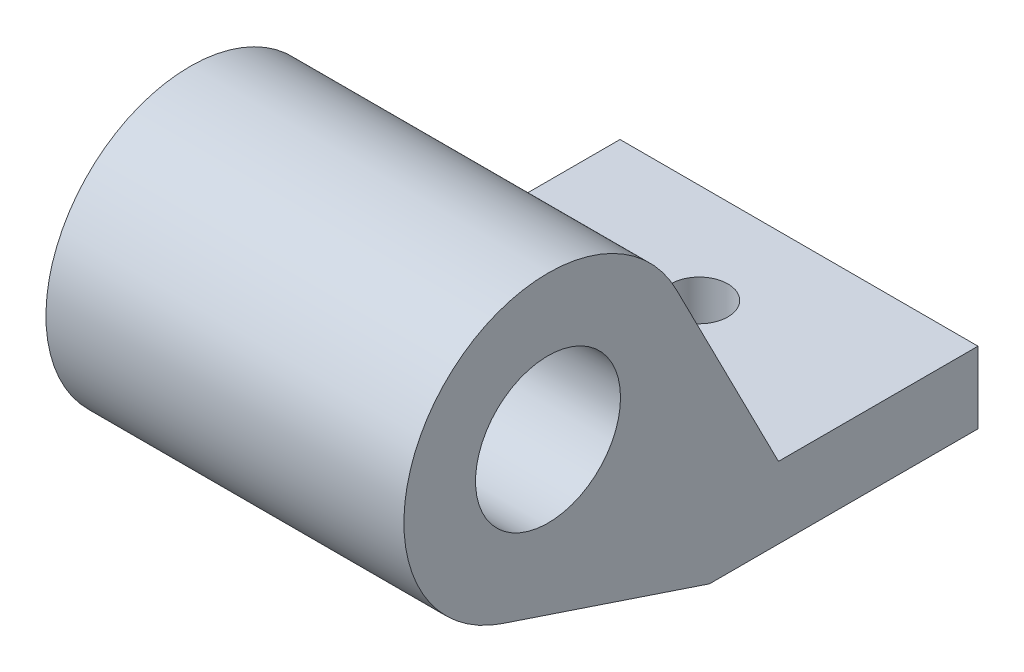
from build123d import *

# Parameters (mm, degrees)
SKETCH1_R           = 4.05
BOSS_EXTRUDE1_DEPTH = 20
SKETCH2_R           = 1.6
CUT_EXTRUDE1_DEPTH  = 36.293010976


with BuildPart() as part:
    # Sketch1 → Boss-Extrude1 (new body)
    with BuildSketch(Plane(origin=(0, 0, 0), x_dir=(0, 0, -1), z_dir=(1, 0, 0))):
        with BuildLine():
            Line((-7.5, 0), (7.5, 0))
            Line((7.5, 0), (7.5, 4))
            Line((7.5, 4), (-3.648390643, 4))
            Line((-3.648390643, 4), (-9.354926755, 15.163309731))
            ThreePointArc((-9.354926755, 15.163309731), (-22.626275854, 16.747943966), (-19.072034972, 3.863567989))
            Line((-19.072034972, 3.863567989), (-7.5, 0))
        make_face()
        with Locations((-16.5227062, 11.499235793)):
            Circle(SKETCH1_R, mode=Mode.SUBTRACT)
    extrude(amount=BOSS_EXTRUDE1_DEPTH)

    # Sketch2 → Cut-Extrude1 (cut, through all)
    with BuildSketch(Plane(origin=(0, 4, 0), x_dir=(1, 0, 0), z_dir=(0, 1, 0))):
        with Locations((10, 1.925804679)):
            Circle(SKETCH2_R)
    extrude(amount=-CUT_EXTRUDE1_DEPTH, mode=Mode.SUBTRACT)


solid = part.part
